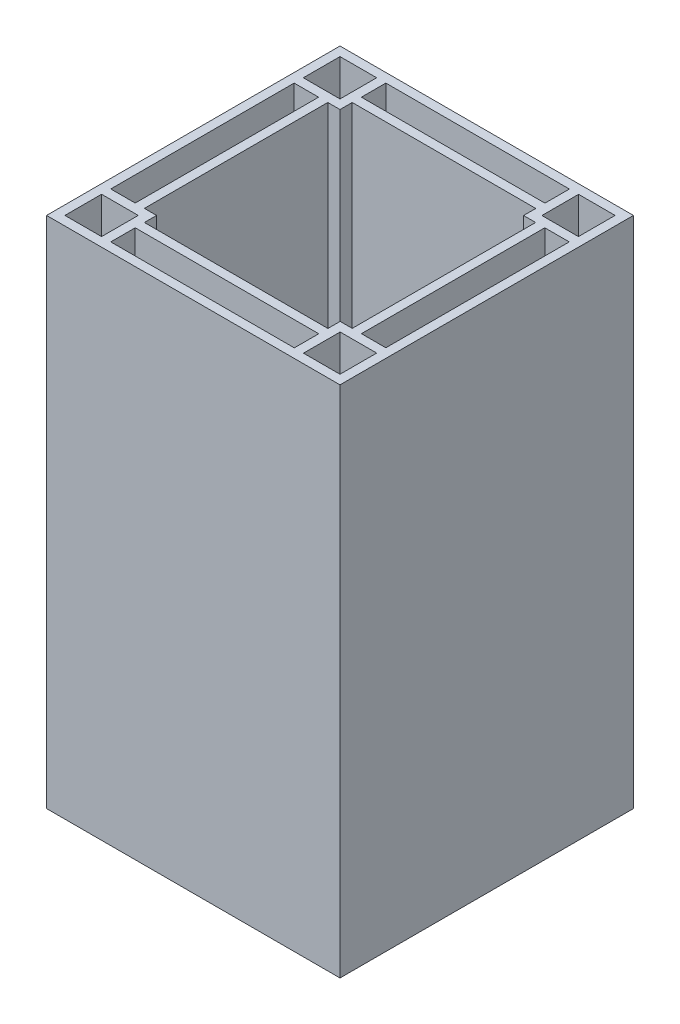
from build123d import *

# Parameters (mm, degrees)
SKETCH1_W               = 101.6
SKETCH1_H               = 203.2
BOSS_EXTRUDE1_DEPTH     = 101.6
SKETCH2_W               = 12.7
SKETCH2_H               = 12.7
SKETCH2_W_2             = 12.648057186
CUT_EXTRUDE1_DEPTH      = 203.2
SKETCH3_W               = 8.46582
SKETCH3_H               = 63.5
SKETCH3_W_2             = 63.551942814
SKETCH3_H_2             = 8.46582
SKETCH3_W_3             = 8.466582
CUT_EXTRUDE2_DEPTH      = 200.025
SKETCH4_W               = 101.6
SKETCH4_H               = 25.341987408
CUT_EXTRUDE3_DEPTH      = 101.6
F_1_2_13_TAPPED_HOLE2_D = 10.71626


with BuildPart() as part:
    # Sketch1 → Boss-Extrude1 (new body)
    with BuildSketch(Plane(origin=(0, 0, 0), x_dir=(0, 0, -1), z_dir=(1, 0, 0))):
        Rectangle(SKETCH1_W, SKETCH1_H)
    extrude(amount=BOSS_EXTRUDE1_DEPTH)

    # Sketch2 → Cut-Extrude1 (cut)
    with BuildSketch(Plane(origin=(0, 101.6, 0), x_dir=(1, 0, 0), z_dir=(0, 1, 0))):
        with Locations((9.525, 41.275)):
            Rectangle(SKETCH2_W, SKETCH2_H)
        with Locations((9.525, -41.275)):
            Rectangle(SKETCH2_W, SKETCH2_H)
        with Locations((92.100971407, -41.275)):
            Rectangle(SKETCH2_W_2, SKETCH2_H)
        with Locations((92.100971407, 41.275)):
            Rectangle(SKETCH2_W_2, SKETCH2_H)
    extrude(amount=-CUT_EXTRUDE1_DEPTH, mode=Mode.SUBTRACT)

    # Sketch3 → Cut-Extrude2 (cut)
    with BuildSketch(Plane(origin=(0, 101.6, 0), x_dir=(1, 0, 0), z_dir=(0, 1, 0))):
        with Locations((7.40791, 0)):
            Rectangle(SKETCH3_W, SKETCH3_H)
        with Locations((50.825971407, 43.39209)):
            Rectangle(SKETCH3_W_2, SKETCH3_H_2)
        with Locations((94.191709, 0)):
            Rectangle(SKETCH3_W_3, SKETCH3_H)
        with Locations((50.825971407, -43.39209)):
            Rectangle(SKETCH3_W_2, SKETCH3_H_2)
        Polygon((82.601942814, 35.98418), (19.05, 35.98418), (19.05, 31.75), (14.81582, 31.75), (14.81582, -31.75), (19.05, -31.75), (19.05, -35.98418), (82.601942814, -35.98418), (82.601942814, -31.75), (86.783418, -31.75), (86.783418, 31.75), (82.601942814, 31.75), align=None)
    extrude(amount=-CUT_EXTRUDE2_DEPTH, mode=Mode.SUBTRACT)

    # Sketch4 → Cut-Extrude3 (cut)
    with BuildSketch(Plane(origin=(101.6, 0, 0), x_dir=(0, 0, -1), z_dir=(1, 0, 0))):
        with Locations((0, 88.929006296)):
            Rectangle(SKETCH4_W, SKETCH4_H)
    extrude(amount=-CUT_EXTRUDE3_DEPTH, mode=Mode.SUBTRACT)

    # 1/2-13 Tapped Hole2 (through all)
    with Locations(Plane(origin=(50.825971407, -98.425, 0), x_dir=(0, 0, 1), z_dir=(0, 1, 0))):
        with Locations((0, 0)):
            Hole(F_1_2_13_TAPPED_HOLE2_D / 2)


solid = part.part
